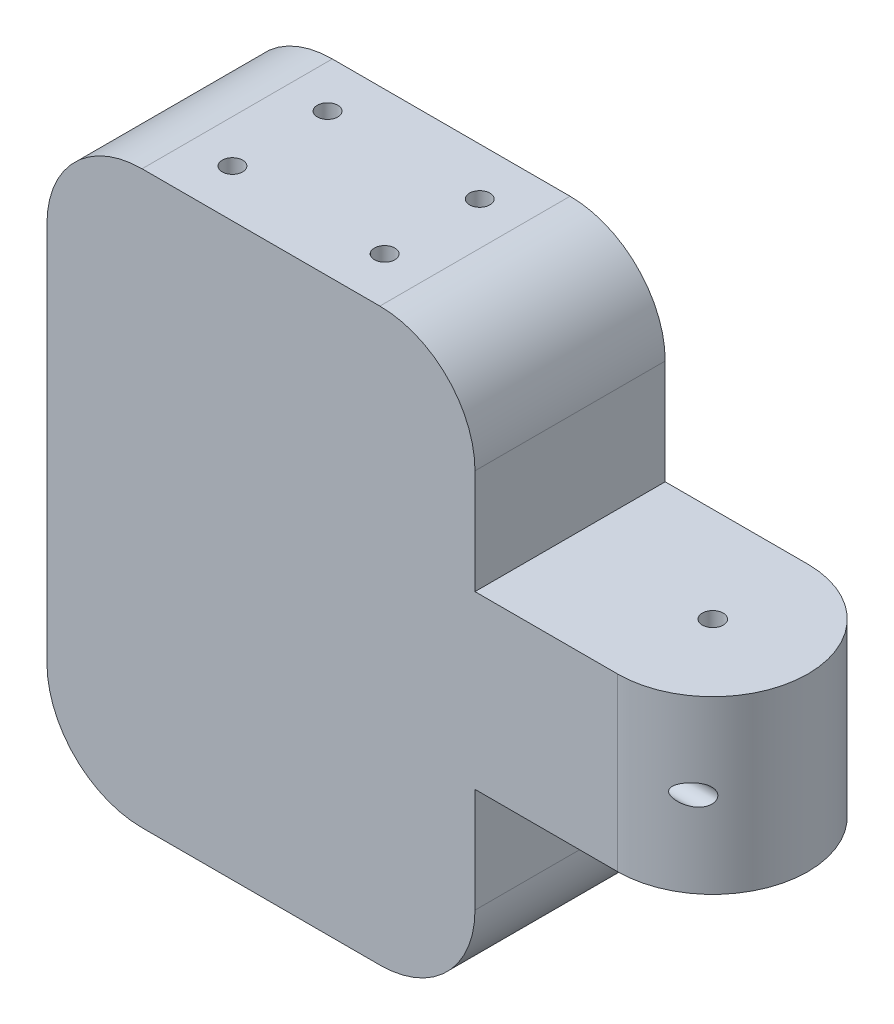
from build123d import *

# Parameters (mm, degrees)
SKETCH1_R              = 1.1
HINGE_DEPTH            = 9
SKETCH3_W              = 20
SKETCH3_H              = 60
THUMB_FLAP_DEPTH       = 45
TENDON_PATH_DEPTH      = 102.612007165
TENDON_PATH_DEPTH_BACK = 102.612007165
SKETCH4_R              = 1.1
M2_PINS_DEPTH          = 78.620873565
M2_PINS_DEPTH_BACK     = 4.2
SKETCH5_R              = 1.075
FILLET1_R              = 10


with BuildPart() as part:
    # Sketch1 → hinge (new, symmetric)
    with BuildSketch(Plane(origin=(0, 0, 0), x_dir=(1, 0, 0), z_dir=(0, 1, 0))):
        with BuildLine():
            Line((15, 20), (0, 20))
            Line((0, 20), (0, 0))
            Line((0, 0), (15, 0))
            ThreePointArc((15, 0), (25, 10), (15, 20))
        make_face()
        with Locations((15, 10)):
            Circle(SKETCH1_R, mode=Mode.SUBTRACT)
    extrude(amount=HINGE_DEPTH, both=True)

    # Sketch3 → thumb_flap (add)
    with BuildSketch(Plane.ZY):
        with Locations((-10, 0)):
            Rectangle(SKETCH3_W, SKETCH3_H)
    extrude(amount=THUMB_FLAP_DEPTH)

    # Sketch4 → tendon_path (cut, two sides: drawn at the far end of the back side and taken through both)
    with BuildSketch(Plane(origin=(50, 0, 0), x_dir=(0, 0, -1), z_dir=(1, 0, 0)).offset(-TENDON_PATH_DEPTH_BACK)):
        with Locations((2.1, 0)):
            Circle(SKETCH4_R)
    extrude(amount=TENDON_PATH_DEPTH + TENDON_PATH_DEPTH_BACK, mode=Mode.SUBTRACT)

    # Sketch5 → m2_pins (cut, two sides: drawn at the far end of the back side and taken through both)
    with BuildSketch(Plane(origin=(0, 30, 0), x_dir=(1, 0, 0), z_dir=(0, 1, 0)).offset(-M2_PINS_DEPTH_BACK)):
        with Locations((-30.5, 15)):
            Circle(SKETCH5_R)
        with Locations((-14.5, 15)):
            Circle(SKETCH5_R)
        with Locations((-14.5, 5)):
            Circle(SKETCH5_R)
        with Locations((-30.5, 5)):
            Circle(SKETCH5_R)
    extrude(amount=M2_PINS_DEPTH + M2_PINS_DEPTH_BACK, mode=Mode.SUBTRACT)

    # Fillet1
    fillet1_edges = [part.edges().sort_by_distance(p)[0] for p in [
        (0, 30, -10),
        (-45, 30, -10),
        (0, -30, -10),
        (-45, -30, -10),
    ]]
    fillet(fillet1_edges, radius=FILLET1_R)


solid = part.part
